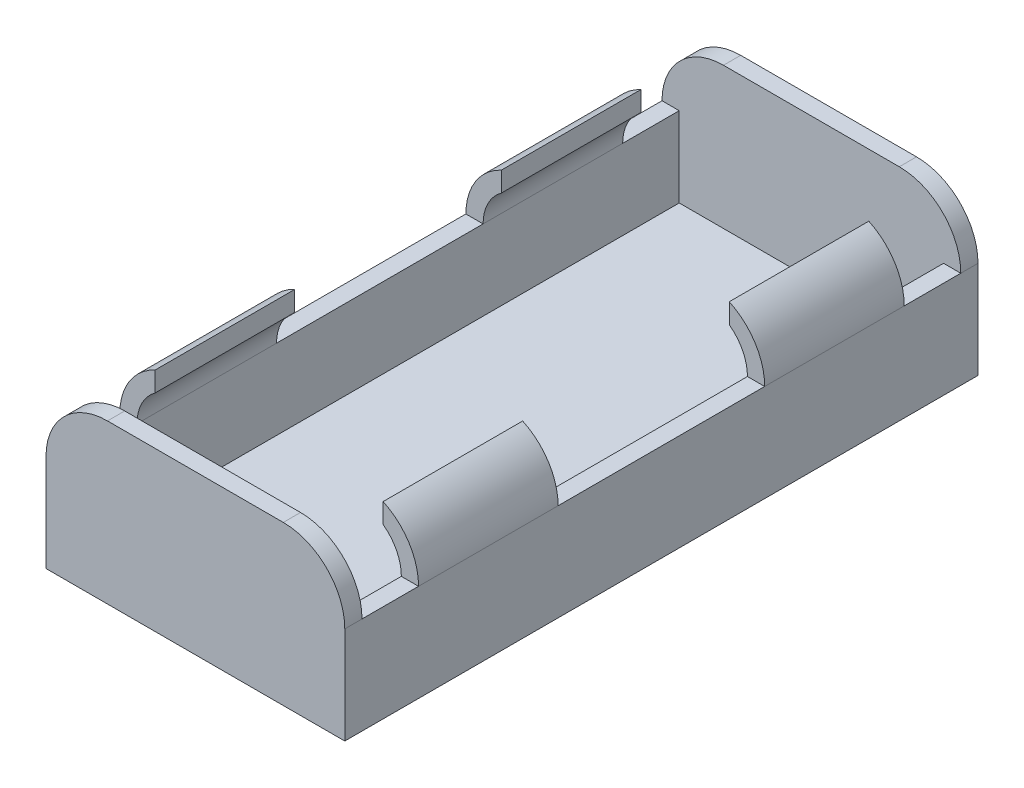
from build123d import *

# Parameters (mm, degrees)
SKETCH1_W           = 24.3
SKETCH1_H           = 12.9
BOSS_EXTRUDE1_DEPTH = 51.5
FILLET1_R           = 5
SHELL1_START        = 1.4
SHELL1_DEPTH        = 48.7
SKETCH2_W           = 18.539285396
SKETCH2_H           = 48.7
CUT_EXTRUDE1_DEPTH  = 5
SKETCH3_W           = 24.3
SKETCH3_H           = 4.6
SKETCH3_H_2         = 16.8
CUT_EXTRUDE2_DEPTH  = 5


# Read off the part's stored shape, not the designer's step: Shell1
with BuildPart() as part:
    # Sketch1 → Boss-Extrude1 (new body)
    with BuildSketch(Plane.XY):
        Rectangle(SKETCH1_W, SKETCH1_H)
    extrude(amount=BOSS_EXTRUDE1_DEPTH)

    # Fillet1
    fillet1_edges = [part.edges().sort_by_distance(p)[0] for p in [
        (-12.15, 6.45, 25.75),
        (12.15, 6.45, 25.75),
    ]]
    fillet(fillet1_edges, radius=FILLET1_R)

    # Shell1 outline → Shell1 (cut)
    with BuildSketch(Plane.XY.offset(SHELL1_START)):
        with BuildLine():
            Line((7.15, 5.05), (7.15, 6.45))
            Line((7.15, 6.45), (-7.15, 6.45))
            Line((-7.15, 6.45), (-7.15, 5.05))
            ThreePointArc((-7.15, 5.05), (-9.695584412, 3.995584412), (-10.75, 1.45))
            Line((-10.75, 1.45), (-10.75, -5.05))
            Line((-10.75, -5.05), (10.75, -5.05))
            Line((10.75, -5.05), (10.75, 1.45))
            ThreePointArc((10.75, 1.45), (9.695584412, 3.995584412), (7.15, 5.05))
        make_face()
    extrude(amount=SHELL1_DEPTH, mode=Mode.SUBTRACT)

    # Sketch2 → Cut-Extrude1 (cut)
    with BuildSketch(Plane(origin=(0, 6.45, 0), x_dir=(1, 0, 0), z_dir=(0, 1, 0))):
        with Locations((0, -25.75)):
            Rectangle(SKETCH2_W, SKETCH2_H)
    extrude(amount=-CUT_EXTRUDE1_DEPTH, mode=Mode.SUBTRACT)

    # Sketch3 → Cut-Extrude2 (cut)
    with BuildSketch(Plane(origin=(0, 6.45, 0), x_dir=(1, 0, 0), z_dir=(0, 1, 0))):
        with Locations((0, -3.7)):
            Rectangle(SKETCH3_W, SKETCH3_H)
        with Locations((0, -47.8)):
            Rectangle(SKETCH3_W, SKETCH3_H)
        with Locations((0, -25.75)):
            Rectangle(SKETCH3_W, SKETCH3_H_2)
    extrude(amount=-CUT_EXTRUDE2_DEPTH, mode=Mode.SUBTRACT)


solid = part.part
